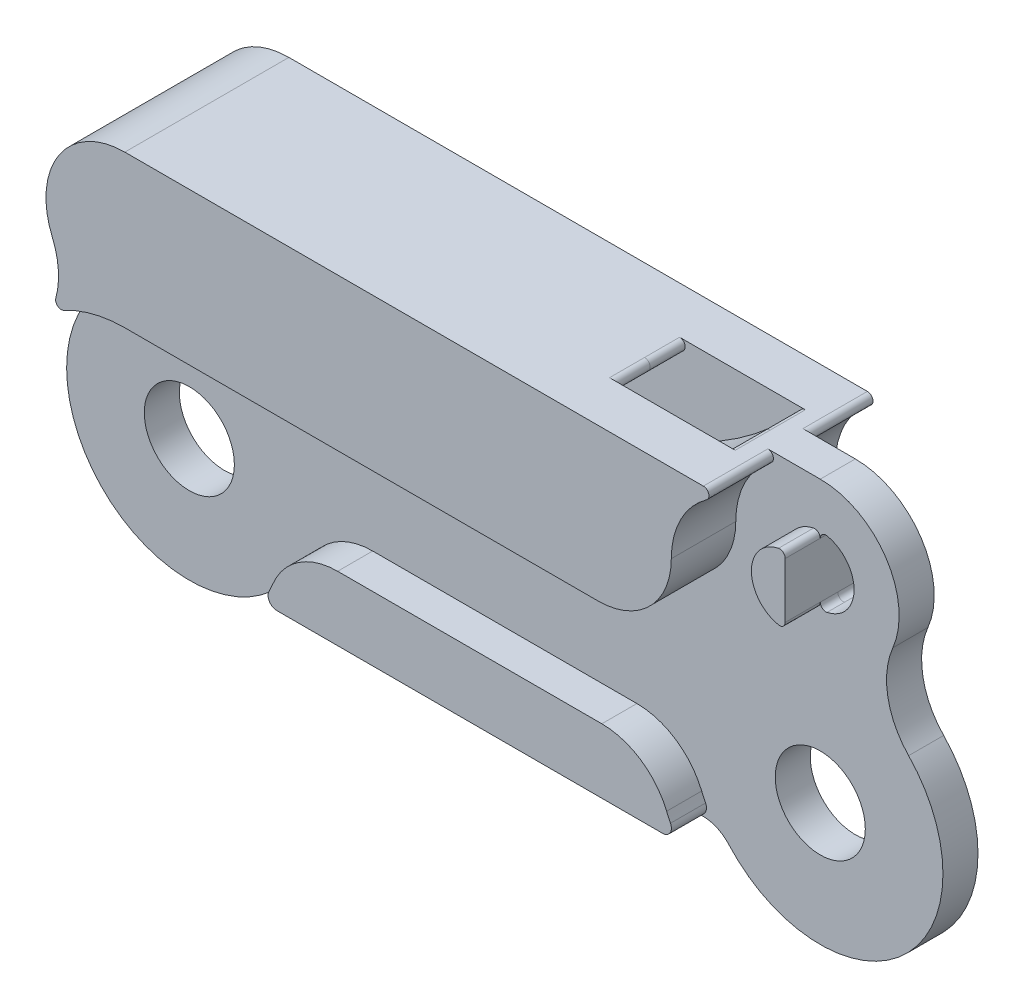
from build123d import *

# Parameters (mm, degrees)
SKETCH2_R           = 2.0399375
BOSS_EXTRUDE1_DEPTH = 3.71475
CUT_EXTRUDE1_DEPTH  = 1.5875
CUT_EXTRUDE5_DEPTH  = 37.606441976
CUT_EXTRUDE6_START  = -2.921
SKETCH4_R           = 2.0399375
SKETCH4_R_2         = 1.532001
CUT_EXTRUDE6_DEPTH  = 2.921
CUT_EXTRUDE7_START  = -1.3335
CUT_EXTRUDE7_DEPTH  = 1.3335
FILLET7_R           = 1.5875
FILLET8_R           = 0.254
FILLET9_R           = 0.254
FILLET10_R          = 3.175
FILLET11_R          = 0.396875
MIRROR1_START       = -3.71475
MIRROR1_DEPTH       = 2.12725
MIRROR1_START_2     = -0.79375
MIRROR1_2_OUTLINE_R = 2.0399375
MIRROR1_2_DEPTH     = 0.79375
MIRROR1_START_3     = -2.38125
MIRROR1_3_DEPTH     = 1.5875


# Read off the part's stored shape, not the designer's step: Mirror1
with BuildPart() as part:
    # Sketch2 → Boss-Extrude1 (new body)
    with BuildSketch(Plane.XY):
        with BuildLine():
            ThreePointArc((-4.001636291, 3.854714135), (-3.525917183, -4.294161394), (4.559746601, -3.175))
            Line((4.559746601, -3.175), (24.015253399, -3.175))
            ThreePointArc((24.015253399, -3.175), (32.100917183, -4.294161394), (32.576636291, 3.854714135))
            ThreePointArc((32.576636291, 3.854714135), (31.636446649, 5.685103372), (31.862058429, 7.730434799))
            ThreePointArc((31.862058429, 7.730434799), (31.554149686, 11.098647308), (28.575, 12.7))
            Line((28.575, 12.7), (0, 12.7))
            ThreePointArc((0, 12.7), (-2.979149712, 11.098647268), (-3.287058392, 7.730434711))
            ThreePointArc((-3.287058392, 7.730434711), (-3.061446658, 5.685103325), (-4.001636291, 3.854714135))
        make_face()
        Circle(SKETCH2_R, mode=Mode.SUBTRACT)
        with Locations((28.575, 0)):
            Circle(SKETCH2_R, mode=Mode.SUBTRACT)
    extrude(amount=BOSS_EXTRUDE1_DEPTH)

    # Sketch3 → Cut-Extrude1 (cut)
    with BuildSketch(Plane.XY):
        with BuildLine():
            Line((5.215962398, 10.715625), (-3.571875, 10.715625))
            Line((-3.571875, 10.715625), (-3.571875, 7.540625))
            Line((-3.571875, 7.540625), (14.2875, 7.540625))
            ThreePointArc((14.2875, 7.540625), (9.481945415, 8.357299211), (5.215962398, 10.715625))
        make_face()
        with BuildLine():
            Line((14.2875, 10.715625), (5.215962398, 10.715625))
            ThreePointArc((5.215962398, 10.715625), (9.481945415, 8.357299211), (14.2875, 7.540625))
            Line((14.2875, 7.540625), (14.2875, 10.715625))
        make_face()
        with BuildLine():
            ThreePointArc((20.705822349, 12.7), (17.646540262, 11.22303906), (14.2875, 10.715625))
            Line((14.2875, 10.715625), (14.2875, 7.540625))
            ThreePointArc((14.2875, 7.540625), (20.41340415, 8.893365099), (25.4, 12.7))
            Line((25.4, 12.7), (20.705822349, 12.7))
        make_face()
    extrude(amount=CUT_EXTRUDE1_DEPTH, mode=Mode.SUBTRACT)

    # Sketch2<11> → Cut-Extrude5 (cut, through all)
    with BuildSketch(Plane.XY):
        with BuildLine():
            ThreePointArc((30.107001, 9.128125), (29.658288296, 10.211413296), (28.575, 10.660126))
            Line((28.575, 10.660126), (28.575, 7.596124))
            ThreePointArc((28.575, 7.596124), (29.658288296, 8.044836704), (30.107001, 9.128125))
        make_face()
    extrude(amount=CUT_EXTRUDE5_DEPTH, mode=Mode.SUBTRACT)

    # Sketch4 → Cut-Extrude6 (cut)
    with BuildSketch(Plane.XY.offset(3.71475).offset(CUT_EXTRUDE6_START)):
        with BuildLine():
            ThreePointArc((-4.001636291, 3.854714135), (-3.525917183, -4.294161394), (4.559746601, -3.175))
            Line((4.559746601, -3.175), (4.866043574, -3.175))
            ThreePointArc((4.866043574, -3.175), (5.531656893, -1.777576181), (5.804695432, -0.254))
            Line((5.804695432, -0.254), (22.770304568, -0.254))
            ThreePointArc((22.770304568, -0.254), (23.043343107, -1.777576181), (23.708956426, -3.175))
            Line((23.708956426, -3.175), (24.015253399, -3.175))
            ThreePointArc((24.015253399, -3.175), (32.100917183, -4.294161394), (32.576636291, 3.854714135))
            ThreePointArc((32.576636291, 3.854714135), (31.636446649, 5.685103372), (31.862058429, 7.730434799))
            ThreePointArc((31.862058429, 7.730434799), (31.554149686, 11.098647308), (28.575, 12.7))
            Line((28.575, 12.7), (27.204223395, 12.7))
            ThreePointArc((27.204223395, 12.7), (25.422085518, 11.295254389), (24.749125, 9.128125))
            ThreePointArc((24.749125, 9.128125), (23.777341912, 6.782033088), (21.43125, 5.81025))
            Line((21.43125, 5.81025), (0, 5.81025))
            ThreePointArc((0, 5.81025), (-1.778548333, 5.531344402), (-3.386347701, 4.72140385))
            ThreePointArc((-3.386347701, 4.72140385), (-3.661573813, 4.265044368), (-4.001636291, 3.854714135))
        make_face()
        Circle(SKETCH4_R, mode=Mode.SUBTRACT)
        with Locations((28.575, 0)):
            Circle(SKETCH4_R, mode=Mode.SUBTRACT)
        with Locations((28.575, 9.128125)):
            Circle(SKETCH4_R_2, mode=Mode.SUBTRACT)
    extrude(amount=CUT_EXTRUDE6_DEPTH, mode=Mode.SUBTRACT)

    # Sketch4<4> → Cut-Extrude7 (cut)
    with BuildSketch(Plane.XY.offset(3.71475).offset(CUT_EXTRUDE7_START)):
        with BuildLine():
            Line((22.770304568, -0.254), (5.804695432, -0.254))
            ThreePointArc((5.804695432, -0.254), (5.531656893, -1.777576181), (4.866043574, -3.175))
            Line((4.866043574, -3.175), (23.708956426, -3.175))
            ThreePointArc((23.708956426, -3.175), (23.043343107, -1.777576181), (22.770304568, -0.254))
        make_face()
        with BuildLine():
            Line((28.575, 7.596124), (28.575, 10.660126))
            ThreePointArc((28.575, 10.660126), (27.042999, 9.128125), (28.575, 7.596124))
        make_face()
    extrude(amount=CUT_EXTRUDE7_DEPTH, mode=Mode.SUBTRACT)

    # Fillet7
    # the kernel refuses this fillet: 1.5875 mm, written as the material it adds along each edge
    with BuildSketch(Plane(origin=(24.015253399, -3.175, 0), x_dir=(-1, 0, 0), z_dir=(0, 0, 1))) as fillet7_piece_1_section:
        with BuildLine():
            CenterArc((0.764890271, 1.5875), FILLET7_R, 221.810314896, 48.189685104)
            ThreePointArc((-0.418362367, 0.529166667), (-0.201143179, 0.270938228), (0, 0))
            Line((0, 0), (0.764890271, 0))
        make_face()
    fillet7_piece_1 = extrude(amount=0.79375, mode=Mode.PRIVATE)
    fillet7_piece_1 = fillet7_piece_1 - Plane(origin=(28.575, 0, 0.396875), x_dir=(-0.9990440053979357, -0.04371584699453488, 0), z_dir=(0, 0, -1)) * Cylinder(5.81025, 5, mode=Mode.PRIVATE)
    add(fillet7_piece_1)
    with BuildSketch(Plane(origin=(24.015253399, -3.175, 0), x_dir=(-1, 0, 0), z_dir=(0, 0, 1))) as fillet7_piece_2_section:
        with BuildLine():
            CenterArc((0.764890271, 1.5875), FILLET7_R, 221.810314896, 48.189685104)
            ThreePointArc((-0.418362367, 0.529166667), (-0.201143179, 0.270938228), (0, 0))
            Line((0, 0), (0.764890271, 0))
        make_face()
    fillet7_piece_2 = extrude(amount=0.79375, mode=Mode.PRIVATE)
    fillet7_piece_2 = fillet7_piece_2 & Plane(origin=(28.575, 0, 0.396875), x_dir=(-0.9990440053979357, -0.04371584699453488, 0), z_dir=(0, 0, -1)) * Cylinder(5.81025, 5, mode=Mode.PRIVATE)
    add(fillet7_piece_2)
    with BuildSketch(Plane(origin=(24.015253399, -3.175, 0), x_dir=(-1, 0, 0), z_dir=(0, 0, 1))) as fillet7_piece_3_section:
        with BuildLine():
            CenterArc((0.764890271, 1.5875), FILLET7_R, 221.810314896, 48.189685104)
            ThreePointArc((-0.418362367, 0.529166667), (-0.201143179, 0.270938228), (0, 0))
            Line((0, 0), (0.764890271, 0))
        make_face()
    fillet7_piece_3 = extrude(amount=2.705975677, mode=Mode.PRIVATE)
    fillet7_piece_3 = split(fillet7_piece_3, bisect_by=Plane(origin=(23.539616467, -3.178074263, 0.79375), z_dir=(0, 0, 1)), keep=Keep.TOP, mode=Mode.PRIVATE)
    fillet7_piece_3 = fillet7_piece_3 - Plane(origin=(28.575, 0, 1.5875), x_dir=(-0.9990440053979357, -0.04371584699453488, 0), z_dir=(0, 0, -1)) * Cylinder(5.81025, 9, mode=Mode.PRIVATE)
    fillet7_piece_3 = split(fillet7_piece_3, bisect_by=Plane(origin=(23.539616467, -3.178074263, 2.38125), z_dir=(0, 0, -1)), keep=Keep.TOP, mode=Mode.PRIVATE)
    add(fillet7_piece_3)
    with BuildSketch(Plane(origin=(4.559746601, -3.175, 0), x_dir=(-0.6201913572080736, -0.7844505595921312, 0), z_dir=(0, 0, 1))) as fillet7_piece_4_section:
        with BuildLine():
            CenterArc((0.770936928, 1.58457238), FILLET7_R, 218.330109737, 48.189685104)
            Line((-0.474378335, 0.600018601), (0, 0))
            ThreePointArc((0, 0), (0.337284906, 0.010246668), (0.674569812, 0))
        make_face()
    fillet7_piece_4 = extrude(amount=0.79375, mode=Mode.PRIVATE)
    fillet7_piece_4 = fillet7_piece_4 & Plane(origin=(0, 0, 0.396875), x_dir=(0.8374929777271225, -0.5464480874316952, 0), z_dir=(0, 0, -1)) * Cylinder(5.81025, 5, mode=Mode.PRIVATE)
    add(fillet7_piece_4)
    with BuildSketch(Plane(origin=(4.559746601, -3.175, 0), x_dir=(-0.6201913572080736, -0.7844505595921312, 0), z_dir=(0, 0, 1))) as fillet7_piece_5_section:
        with BuildLine():
            CenterArc((0.770936928, 1.58457238), FILLET7_R, 218.330109737, 48.189685104)
            Line((-0.474378335, 0.600018601), (0, 0))
            ThreePointArc((0, 0), (0.337284906, 0.010246668), (0.674569812, 0))
        make_face()
    fillet7_piece_5 = extrude(amount=0.79375, mode=Mode.PRIVATE)
    fillet7_piece_5 = fillet7_piece_5 - Plane(origin=(0, 0, 0.396875), x_dir=(0.8374929777271225, -0.5464480874316952, 0), z_dir=(0, 0, -1)) * Cylinder(5.81025, 5, mode=Mode.PRIVATE)
    add(fillet7_piece_5)
    with BuildSketch(Plane(origin=(4.559746601, -3.175, 0), x_dir=(-0.6201913572080736, -0.7844505595921312, 0), z_dir=(0, 0, 1))) as fillet7_piece_6_section:
        with BuildLine():
            CenterArc((0.770936928, 1.58457238), FILLET7_R, 218.330109737, 48.189685104)
            Line((-0.474378335, 0.600018601), (0, 0))
            ThreePointArc((0, 0), (0.337284906, 0.010246668), (0.674569812, 0))
        make_face()
    fillet7_piece_6 = extrude(amount=2.705975677, mode=Mode.PRIVATE)
    fillet7_piece_6 = split(fillet7_piece_6, bisect_by=Plane(origin=(5.035383533, -3.178074263, 0.79375), z_dir=(0, 0, 1)), keep=Keep.TOP, mode=Mode.PRIVATE)
    fillet7_piece_6 = split(fillet7_piece_6, bisect_by=Plane(origin=(5.035383533, -3.178074263, 2.38125), z_dir=(0, 0, -1)), keep=Keep.TOP, mode=Mode.PRIVATE)
    fillet7_piece_6 = fillet7_piece_6 - Plane(origin=(0, 0, 1.5875), x_dir=(0.8374929777271225, -0.5464480874316952, 0), z_dir=(0, 0, -1)) * Cylinder(5.81025, 9, mode=Mode.PRIVATE)
    add(fillet7_piece_6)

    # Fillet8
    fillet8_edges = [part.edges().sort_by_distance(p)[0] for p in [
        (-3.386347701, 4.72140385, 2.25425),
        (27.204223395, 12.7, 2.25425),
        (28.575, 7.596124, 1.5875),
        (28.575, 10.660126, 1.5875),
        (-3.199708544, 10.715625, 0.79375),
        (-3.212671341, 7.540625, 0.79375),
        (25.4, 12.7, 0.79375),
        (20.705822349, 12.7, 0.79375),
    ]]
    fillet(fillet8_edges, radius=FILLET8_R)

    # Fillet9
    fillet9_edges = [part.edges().sort_by_distance(p)[0] for p in [
        (28.575, 7.596124, 0.396875),
        (28.575, 10.660126, 0.396875),
    ]]
    fillet(fillet9_edges, radius=FILLET9_R)

    # Fillet10
    fillet10_edges = [part.edges().sort_by_distance(p)[0] for p in [
        (22.770304568, -0.254, 1.5875),
        (5.804695432, -0.254, 1.5875),
    ]]
    fillet(fillet10_edges, radius=FILLET10_R)

    # Fillet11
    # the kernel refuses this fillet: 0.396875 mm, written as the material it takes off along each edge
    with BuildSketch(Plane(origin=(4.808716583, -3.261173085, 4.295563111), x_dir=(0.5055235209104179, 0.8628128243172642, 0), z_dir=(0, 0, -1))) as fillet11_piece_1:
        with BuildLine():
            CenterArc((0.791877063, 0.396012434), FILLET11_R, 149.633888985, 116.587905539)
            Line((0.449448223, 0.596642082), (0.415205339, 0.616705046))
            ThreePointArc((0.415205339, 0.616705046), (0.3009182, 0.421643085), (-0.025863857, 0.030102468))
            Line((-0.025863857, 0.030102468), (0.002615182, -0.039601243))
            ThreePointArc((0.002615182, -0.039601243), (0.382862622, -0.027059536), (0.763110063, -0.039601243))
            Line((0.763110063, -0.039601243), (0.765725244, 0))
        make_face()
    extrude(amount=3.501813111, mode=Mode.SUBTRACT)
    with BuildSketch(Plane(origin=(23.766283417, -3.261173085, 4.295563111), x_dir=(-0.5055235209104277, 0.8628128243172586, 0), z_dir=(0, 0, -1))) as fillet11_piece_2:
        with BuildLine():
            CenterArc((0.791877063, -0.396012434), FILLET11_R, 93.778205477, 116.587905539)
            Line((0.449448223, -0.596642082), (0.415205339, -0.616705046))
            ThreePointArc((0.415205339, -0.616705046), (0.3009182, -0.421643085), (-0.025863857, -0.030102468))
            Line((-0.025863857, -0.030102468), (0.002615182, 0.039601243))
            ThreePointArc((0.002615182, 0.039601243), (0.382862622, 0.027059536), (0.763110063, 0.039601243))
            Line((0.763110063, 0.039601243), (0.765725244, 0))
        make_face()
    extrude(amount=3.501813111, mode=Mode.SUBTRACT)

    # Mirror1 2 outline → Mirror1 2 (add)
    # profile 1 of 2: a face of its own
    with BuildSketch(Plane.XY.offset(MIRROR1_START_2)):
        with BuildLine():
            ThreePointArc((4.141384233, -3.704166667), (4.67654271, -3.3133174), (5.324636871, -3.175))
            Line((5.324636871, -3.175), (23.250363129, -3.175))
            ThreePointArc((23.250363129, -3.175), (23.89845729, -3.3133174), (24.433615767, -3.704166667))
            ThreePointArc((24.433615767, -3.704166667), (32.355086231, -4.072206054), (32.57663634, 3.854714083))
            ThreePointArc((32.57663634, 3.854714083), (31.636446658, 5.685103328), (31.862058422, 7.730434783))
            ThreePointArc((31.862058422, 7.730434783), (31.554149691, 11.0986473), (28.575, 12.7))
            Line((28.575, 12.7), (25.517309382, 12.7))
            ThreePointArc((25.517309382, 12.7), (25.411268872, 12.676806001), (25.324594531, 12.611459923))
            ThreePointArc((25.324594531, 12.611459923), (20.360613339, 8.868983216), (14.2875, 7.540625))
            Line((14.2875, 7.540625), (-2.869061969, 7.540625))
            ThreePointArc((-2.869061969, 7.540625), (-3.069812253, 7.442237736), (-3.115040716, 7.223296838))
            ThreePointArc((-3.115040716, 7.223296838), (-3.119879404, 5.423605018), (-4.00163634, 3.854714083))
            ThreePointArc((-4.00163634, 3.854714083), (-3.780086231, -4.072206054), (4.141384233, -3.704166667))
        make_face()
        Circle(MIRROR1_2_OUTLINE_R, mode=Mode.SUBTRACT)
        with Locations((28.575, 0)):
            Circle(MIRROR1_2_OUTLINE_R, mode=Mode.SUBTRACT)
        with BuildLine():
            ThreePointArc((28.879481964, 7.626686424), (28.668230629, 7.678974408), (28.575, 7.875619289))
            Line((28.575, 7.875619289), (28.575, 10.380630711))
            ThreePointArc((28.575, 10.380630711), (28.668230629, 10.577275592), (28.879481964, 10.629563576))
            ThreePointArc((28.879481964, 10.629563576), (30.107001, 9.128125), (28.879481964, 7.626686424))
        make_face(mode=Mode.SUBTRACT)
    # profile 2 of 2: a face of its own
    with BuildSketch(Plane.XY.offset(MIRROR1_START_2)):
        with BuildLine():
            ThreePointArc((0, 12.7), (-1.684804778, 12.277684315), (-2.971208445, 11.110601077))
            ThreePointArc((-2.971208445, 11.110601077), (-2.983891173, 10.849816661), (-2.759922511, 10.715625))
            Line((-2.759922511, 10.715625), (14.2875, 10.715625))
            ThreePointArc((14.2875, 10.715625), (17.217764137, 11.099634629), (19.950129906, 12.225729035))
            ThreePointArc((19.950129906, 12.225729035), (20.069074763, 12.511449121), (19.823651837, 12.7))
            Line((19.823651837, 12.7), (0, 12.7))
        make_face()
    extrude(amount=MIRROR1_2_DEPTH)



with BuildPart() as body_2:
    # Mirror1 outline → Mirror1 (new body)
    with BuildSketch(Plane.XY.offset(MIRROR1_START)):
        with BuildLine():
            ThreePointArc((-3.125432568, 5.402761891), (-3.037852661, 5.137483193), (-2.759556449, 5.113106029))
            ThreePointArc((-2.759556449, 5.113106029), (-1.423126972, 5.633268561), (0, 5.81025))
            Line((0, 5.81025), (21.43125, 5.81025))
            ThreePointArc((21.43125, 5.81025), (23.777341912, 6.782033088), (24.749125, 9.128125))
            ThreePointArc((24.749125, 9.128125), (25.172397669, 10.877301061), (26.348558799, 12.239439689))
            ThreePointArc((26.348558799, 12.239439689), (26.442594731, 12.523619846), (26.200745275, 12.7))
            Line((26.200745275, 12.7), (0, 12.7))
            ThreePointArc((0, 12.7), (-2.979149691, 11.0986473), (-3.287058422, 7.730434783))
            ThreePointArc((-3.287058422, 7.730434783), (-3.010821642, 6.580167919), (-3.125432568, 5.402761891))
        make_face()
    extrude(amount=MIRROR1_DEPTH)


with BuildPart() as part_1:
    add(part.part)

    add(body_2.part)  # Mirror1 3 merges body 2
    # Mirror1 3 outline → Mirror1 3 (add)
    with BuildSketch(Plane.XY.offset(MIRROR1_START_3)):
        with BuildLine():
            ThreePointArc((5.195808704, -2.600495524), (5.213070024, -2.986707199), (5.55071367, -3.175))
            Line((5.55071367, -3.175), (23.02428633, -3.175))
            ThreePointArc((23.02428633, -3.175), (23.361929976, -2.986707199), (23.379191296, -2.600495524))
            ThreePointArc((23.379191296, -2.600495524), (23.288366692, -2.410500638), (23.204486818, -2.217339223))
            ThreePointArc((23.204486818, -2.217339223), (22.035226569, -0.790094169), (20.269780162, -0.254))
            Line((20.269780162, -0.254), (8.305219838, -0.254))
            ThreePointArc((8.305219838, -0.254), (6.539773431, -0.790094169), (5.370513182, -2.217339223))
            ThreePointArc((5.370513182, -2.217339223), (5.286633308, -2.410500638), (5.195808704, -2.600495524))
        make_face()
        with BuildLine():
            ThreePointArc((-3.115040716, 7.223296838), (-3.002300034, 6.312356167), (-3.125432568, 5.402761891))
            ThreePointArc((-3.125432568, 5.402761891), (-3.037852661, 5.137483193), (-2.759556449, 5.113106029))
            ThreePointArc((-2.759556449, 5.113106029), (-1.423126972, 5.633268561), (0, 5.81025))
            Line((0, 5.81025), (21.43125, 5.81025))
            ThreePointArc((21.43125, 5.81025), (23.777341912, 6.782033088), (24.749125, 9.128125))
            ThreePointArc((24.749125, 9.128125), (25.172397669, 10.877301061), (26.348558799, 12.239439689))
            ThreePointArc((26.348558799, 12.239439689), (26.442594731, 12.523619846), (26.200745275, 12.7))
            Line((26.200745275, 12.7), (25.517309382, 12.7))
            ThreePointArc((25.517309382, 12.7), (25.411268872, 12.676806001), (25.324594531, 12.611459923))
            ThreePointArc((25.324594531, 12.611459923), (20.360613339, 8.868983216), (14.2875, 7.540625))
            Line((14.2875, 7.540625), (-2.869061969, 7.540625))
            ThreePointArc((-2.869061969, 7.540625), (-3.069812253, 7.442237736), (-3.115040716, 7.223296838))
        make_face()
        with BuildLine():
            ThreePointArc((0, 12.7), (-1.684804778, 12.277684315), (-2.971208445, 11.110601077))
            ThreePointArc((-2.971208445, 11.110601077), (-2.983891173, 10.849816661), (-2.759922511, 10.715625))
            Line((-2.759922511, 10.715625), (14.2875, 10.715625))
            ThreePointArc((14.2875, 10.715625), (17.217764137, 11.099634629), (19.950129906, 12.225729035))
            ThreePointArc((19.950129906, 12.225729035), (20.069074763, 12.511449121), (19.823651837, 12.7))
            Line((19.823651837, 12.7), (0, 12.7))
        make_face()
        with BuildLine():
            ThreePointArc((28.270518036, 7.626686424), (28.481769371, 7.678974408), (28.575, 7.875619289))
            Line((28.575, 7.875619289), (28.575, 10.380630711))
            ThreePointArc((28.575, 10.380630711), (28.481769371, 10.577275592), (28.270518036, 10.629563576))
            ThreePointArc((28.270518036, 10.629563576), (27.042999, 9.128125), (28.270518036, 7.626686424))
        make_face()
    extrude(amount=MIRROR1_3_DEPTH)


solid = part_1.part
